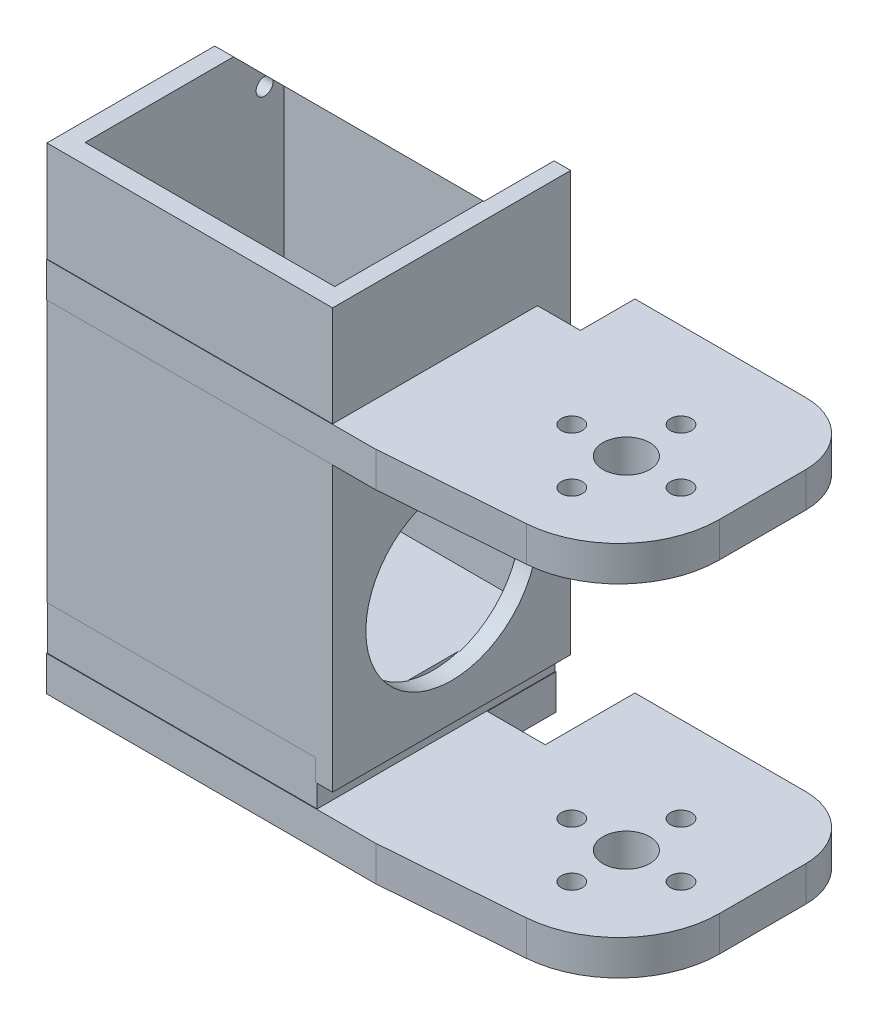
from build123d import *

# Parameters (mm, degrees)
BOSS_1_DEPTH  = 4.5
S_CYL2_R      = 9
BOSS_2_DEPTH  = 2
BOSS_3_DEPTH  = 4.5
S_PRISM4_W    = 7.775
S_PRISM4_H    = 21.81
BOSS_4_DEPTH  = 4.5
S_PRISM5_W    = 42.225
S_PRISM5_H    = 2.6
BOSS_5_DEPTH  = 4.5
S_PRISM6_W    = 34.7
S_PRISM6_H    = 30.62
BOSS_6_DEPTH  = 4.5
S_PRISM7_W    = 7.775
S_PRISM7_H    = 26.31
BOSS_7_DEPTH  = 4.5
S_PRISM8_W    = 42.225
S_PRISM8_H    = 2.6
BOSS_8_DEPTH  = 4.5
S_BOX9_W      = 34.4
S_BOX9_H      = 2.5
BOSS_9_DEPTH  = 30.52
S_BOX10_W     = 34.4
S_BOX10_H     = 51.02
BOSS_10_DEPTH = 2.5
S_BOX11_W     = 34.4
S_BOX11_H     = 51.02
BOSS_11_DEPTH = 2.5
S_BOX12_W     = 2.4
S_BOX12_H     = 51.02
BOSS_12_DEPTH = 30.52
S_BOX13_W     = 2.225
S_BOX13_H     = 53.77
BOSS_13_DEPTH = 30.52
S_BOX14_W     = 34.56
S_BOX14_H     = 5.825
BOSS_14_DEPTH = 30.48
S_HOLE15_R    = 3
HOLE_15_DEPTH = 4.7
S_HOLE16_R    = 1.35
HOLE_16_DEPTH = 4.7
S_HOLE17_R    = 1.35
HOLE_17_DEPTH = 4.7
S_HOLE18_R    = 1.35
HOLE_18_DEPTH = 4.7
S_HOLE19_R    = 1.35
HOLE_19_DEPTH = 4.7
S_HOLE20_R    = 3
HOLE_20_DEPTH = 6.7
S_HOLE21_R    = 1.35
HOLE_21_DEPTH = 6.7
S_HOLE22_R    = 1.35
HOLE_22_DEPTH = 6.7
S_HOLE23_R    = 1.35
HOLE_23_DEPTH = 6.7
S_HOLE24_R    = 1.35
HOLE_24_DEPTH = 6.7
S_HOLE25_R    = 11
HOLE_25_DEPTH = 2.6
S_HOLE26_R    = 1.1
HOLE_26_DEPTH = 2.6
S_HOLE27_R    = 1.1
HOLE_27_DEPTH = 2.6
S_HOLE28_R    = 1.1
HOLE_28_DEPTH = 2.6
S_HOLE29_R    = 11
HOLE_29_DEPTH = 2.425
CUT_30_DEPTH  = 34.6


with BuildPart() as part:
    # S_prism1 → Boss_1 (new body)
    with BuildSketch(Plane(origin=(0, -23.125, 0), x_dir=(1, 0, 0), z_dir=(0, 1, 0))):
        with BuildLine():
            Line((13, 10), (13, -1.0582))
            ThreePointArc((13, -1.0582), (9.566483076, -9.821518282), (1.0937, -13.9199))
            Line((1.0937, -13.9199), (-16.9, -15.31))
            Line((-16.9, -15.31), (-16.9, 18))
            Line((-16.9, 18), (5, 18))
            ThreePointArc((5, 18), (10.6569, 15.6569), (13, 10))
        make_face()
    extrude(amount=BOSS_1_DEPTH)

    # S_prism4 → Boss_4 (add)
    with BuildSketch(Plane(origin=(0, -23.125, 0), x_dir=(1, 0, 0), z_dir=(0, 1, 0))):
        with Locations((-20.6875, -4.405)):
            Rectangle(S_PRISM4_W, S_PRISM4_H)
    extrude(amount=BOSS_4_DEPTH)

    # S_prism5 → Boss_5 (add)
    with BuildSketch(Plane(origin=(0, -23.125, 0), x_dir=(1, 0, 0), z_dir=(0, 1, 0))):
        with Locations((-37.9125, -14.01)):
            Rectangle(S_PRISM5_W, S_PRISM5_H)
    extrude(amount=BOSS_5_DEPTH)

    # S_prism6 → Boss_6 (add)
    with BuildSketch(Plane(origin=(0, -23.125, 0), x_dir=(1, 0, 0), z_dir=(0, 1, 0))):
        with Locations((-41.675, 0)):
            Rectangle(S_PRISM6_W, S_PRISM6_H)
    extrude(amount=BOSS_6_DEPTH)



with BuildPart() as body_2:
    # S_cyl2 → Boss_2 (new body)
    with BuildSketch(Plane(origin=(0, 18.625, 0), x_dir=(1, 0, 0), z_dir=(0, 1, 0))):
        Circle(S_CYL2_R)
    extrude(amount=BOSS_2_DEPTH)

    # S_prism3 → Boss_3 (add)
    with BuildSketch(Plane(origin=(0, 20.625, 0), x_dir=(1, 0, 0), z_dir=(0, 1, 0))):
        with BuildLine():
            Line((13, 10), (13, -1.0582))
            ThreePointArc((13, -1.0582), (9.566483076, -9.821518282), (1.0937, -13.9199))
            Line((1.0937, -13.9199), (-16.9, -15.31))
            Line((-16.9, -15.31), (-16.9, 18))
            Line((-16.9, 18), (5, 18))
            ThreePointArc((5, 18), (10.6569, 15.6569), (13, 10))
        make_face()
    extrude(amount=BOSS_3_DEPTH)

    # S_prism7 → Boss_7 (add)
    with BuildSketch(Plane(origin=(0, 20.625, 0), x_dir=(1, 0, 0), z_dir=(0, 1, 0))):
        with Locations((-20.6875, -2.155)):
            Rectangle(S_PRISM7_W, S_PRISM7_H)
    extrude(amount=BOSS_7_DEPTH)

    # S_prism8 → Boss_8 (add)
    with BuildSketch(Plane(origin=(0, 20.625, 0), x_dir=(1, 0, 0), z_dir=(0, 1, 0))):
        with Locations((-37.9125, -14.01)):
            Rectangle(S_PRISM8_W, S_PRISM8_H)
    extrude(amount=BOSS_8_DEPTH)



with BuildPart() as body_3:
    # S_box9 → Boss_9 (new body)
    with BuildSketch(Plane.XY.offset(-15.26)):
        with Locations((-41.825, -11.76)):
            Rectangle(S_BOX9_W, S_BOX9_H)
    extrude(amount=BOSS_9_DEPTH)

    # S_box10 → Boss_10 (add)
    with BuildSketch(Plane.XY.offset(-15.26)):
        with Locations((-41.825, 12.5)):
            Rectangle(S_BOX10_W, S_BOX10_H)
    extrude(amount=BOSS_10_DEPTH)


with BuildPart() as body_2_1:
    add(body_2.part)

    add(body_3.part)  # Boss_11 merges body 3
    # S_box11 → Boss_11 (add)
    with BuildSketch(Plane.XY.offset(12.76)):
        with Locations((-41.825, 12.5)):
            Rectangle(S_BOX11_W, S_BOX11_H)
    extrude(amount=BOSS_11_DEPTH)

    # S_box12 → Boss_12 (add)
    with BuildSketch(Plane.XY.offset(-15.26)):
        with Locations((-57.825, 12.5)):
            Rectangle(S_BOX12_W, S_BOX12_H)
    extrude(amount=BOSS_12_DEPTH)

    # S_box13 → Boss_13 (add)
    with BuildSketch(Plane.XY.offset(-15.26)):
        with Locations((-23.5125, 11.125)):
            Rectangle(S_BOX13_W, S_BOX13_H)
    extrude(amount=BOSS_13_DEPTH)


with BuildPart() as part_1:
    add(part.part)

    add(body_2_1.part)  # Boss_14 merges body 2
    # S_box14 → Boss_14 (add)
    with BuildSketch(Plane.XY.offset(-15.24)):
        with Locations((-41.675, -15.8125)):
            Rectangle(S_BOX14_W, S_BOX14_H)
    extrude(amount=BOSS_14_DEPTH)

    # S_hole15 → Hole_15 (cut)
    with BuildSketch(Plane(origin=(0, -23.225, 0), x_dir=(1, 0, 0), z_dir=(0, 1, 0))):
        Circle(S_HOLE15_R)
    extrude(amount=HOLE_15_DEPTH, mode=Mode.SUBTRACT)

    # S_hole16 → Hole_16 (cut)
    with BuildSketch(Plane(origin=(0, -23.225, 0), x_dir=(1, 0, 0), z_dir=(0, 1, 0))):
        with Locations((7, 0)):
            Circle(S_HOLE16_R)
    extrude(amount=HOLE_16_DEPTH, mode=Mode.SUBTRACT)

    # S_hole17 → Hole_17 (cut)
    with BuildSketch(Plane(origin=(0, -23.225, 0), x_dir=(1, 0, 0), z_dir=(0, 1, 0))):
        with Locations((0, -7)):
            Circle(S_HOLE17_R)
    extrude(amount=HOLE_17_DEPTH, mode=Mode.SUBTRACT)

    # S_hole18 → Hole_18 (cut)
    with BuildSketch(Plane(origin=(0, -23.225, 0), x_dir=(1, 0, 0), z_dir=(0, 1, 0))):
        with Locations((-7, 0)):
            Circle(S_HOLE18_R)
    extrude(amount=HOLE_18_DEPTH, mode=Mode.SUBTRACT)

    # S_hole19 → Hole_19 (cut)
    with BuildSketch(Plane(origin=(0, -23.225, 0), x_dir=(1, 0, 0), z_dir=(0, 1, 0))):
        with Locations((0, 7)):
            Circle(S_HOLE19_R)
    extrude(amount=HOLE_19_DEPTH, mode=Mode.SUBTRACT)

    # S_hole20 → Hole_20 (cut)
    with BuildSketch(Plane(origin=(0, 18.525, 0), x_dir=(1, 0, 0), z_dir=(0, 1, 0))):
        Circle(S_HOLE20_R)
    extrude(amount=HOLE_20_DEPTH, mode=Mode.SUBTRACT)

    # S_hole21 → Hole_21 (cut)
    with BuildSketch(Plane(origin=(0, 18.525, 0), x_dir=(1, 0, 0), z_dir=(0, 1, 0))):
        with Locations((7, 0)):
            Circle(S_HOLE21_R)
    extrude(amount=HOLE_21_DEPTH, mode=Mode.SUBTRACT)

    # S_hole22 → Hole_22 (cut)
    with BuildSketch(Plane(origin=(0, 18.525, 0), x_dir=(1, 0, 0), z_dir=(0, 1, 0))):
        with Locations((0, -7)):
            Circle(S_HOLE22_R)
    extrude(amount=HOLE_22_DEPTH, mode=Mode.SUBTRACT)

    # S_hole23 → Hole_23 (cut)
    with BuildSketch(Plane(origin=(0, 18.525, 0), x_dir=(1, 0, 0), z_dir=(0, 1, 0))):
        with Locations((-7, 0)):
            Circle(S_HOLE23_R)
    extrude(amount=HOLE_23_DEPTH, mode=Mode.SUBTRACT)

    # S_hole24 → Hole_24 (cut)
    with BuildSketch(Plane(origin=(0, 18.525, 0), x_dir=(1, 0, 0), z_dir=(0, 1, 0))):
        with Locations((0, 7)):
            Circle(S_HOLE24_R)
    extrude(amount=HOLE_24_DEPTH, mode=Mode.SUBTRACT)

    # S_hole25 → Hole_25 (cut)
    with BuildSketch(Plane(origin=(-59.125, 0, 0), x_dir=(0, 0, -1), z_dir=(1, 0, 0))):
        Circle(S_HOLE25_R)
    extrude(amount=HOLE_25_DEPTH, mode=Mode.SUBTRACT)

    # S_hole26 → Hole_26 (cut)
    with BuildSketch(Plane(origin=(-59.125, 0, 0), x_dir=(0, 0, -1), z_dir=(1, 0, 0))):
        with Locations((-10.25, 8.3)):
            Circle(S_HOLE26_R)
    extrude(amount=HOLE_26_DEPTH, mode=Mode.SUBTRACT)

    # S_hole27 → Hole_27 (cut)
    with BuildSketch(Plane(origin=(-59.125, 0, 0), x_dir=(0, 0, -1), z_dir=(1, 0, 0))):
        with Locations((10.25, 32.75)):
            Circle(S_HOLE27_R)
    extrude(amount=HOLE_27_DEPTH, mode=Mode.SUBTRACT)

    # S_hole28 → Hole_28 (cut)
    with BuildSketch(Plane(origin=(-59.125, 0, 0), x_dir=(0, 0, -1), z_dir=(1, 0, 0))):
        with Locations((-10.25, 32.75)):
            Circle(S_HOLE28_R)
    extrude(amount=HOLE_28_DEPTH, mode=Mode.SUBTRACT)

    # S_hole29 → Hole_29 (cut)
    with BuildSketch(Plane(origin=(-24.725, 0, 0), x_dir=(0, 0, -1), z_dir=(1, 0, 0))):
        Circle(S_HOLE29_R)
    extrude(amount=HOLE_29_DEPTH, mode=Mode.SUBTRACT)

    # S_pcut30 → Cut_30 (cut)
    with BuildSketch(Plane(origin=(-59.125, 0, 0), x_dir=(0, 0, -1), z_dir=(1, 0, 0))):
        Polygon((15.86, 38.61), (15.86, 28.41), (5.66, 38.61), align=None)
    extrude(amount=CUT_30_DEPTH, mode=Mode.SUBTRACT)


solid = part_1.part
